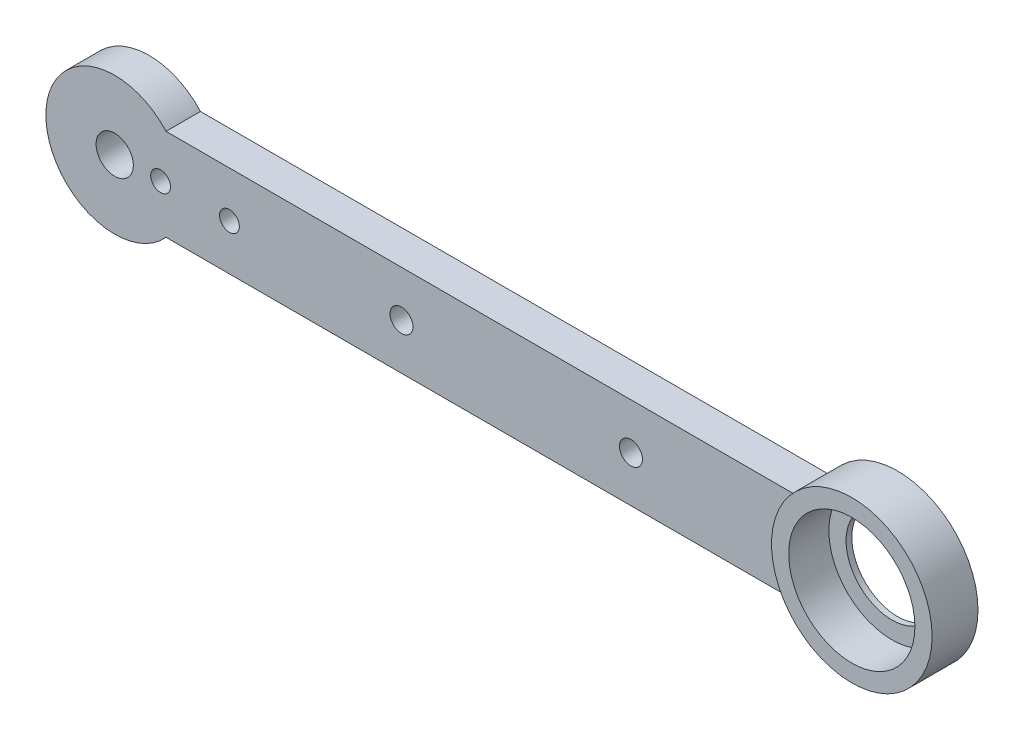
from build123d import *
from build123d.topology import SkipClean

# Parameters (mm, degrees)
BOSS_EXTRUDE1_START     = 3
SKETCH1_W               = 130
SKETCH1_H               = 16
BOSS_EXTRUDE1_DEPTH     = 6
BOSS_EXTRUDE2_START     = 3
SKETCH2_R               = 12
BOSS_EXTRUDE2_DEPTH     = 6
BOSS_EXTRUDE3_START     = 3
SKETCH3_R               = 14
BOSS_EXTRUDE3_DEPTH     = 6
BOSS_EXTRUDE4_START     = 2.5
SKETCH4_R               = 14
BOSS_EXTRUDE4_DEPTH     = 8
CUT_EXTRUDE1_DEPTH      = 146.059470563
CUT_EXTRUDE1_DEPTH_BACK = 146.059470563
SKETCH5_R               = 3.25
CUT_EXTRUDE2_DEPTH      = 146.059470563
CUT_EXTRUDE2_DEPTH_BACK = 146.059470563
SKETCH6_R               = 1.725
CUT_EXTRUDE3_START      = 3
SKETCH7_R               = 2.9
CUT_EXTRUDE3_DEPTH      = 2.2
CUT_EXTRUDE4_START      = 3
SKETCH8_R               = 2.9
CUT_EXTRUDE4_DEPTH      = 2.2
CUT_EXTRUDE5_START      = 3.5
SKETCH9_R               = 11
CUT_EXTRUDE5_DEPTH      = 7
CUT_EXTRUDE6_DEPTH      = 146.059470563
CUT_EXTRUDE6_DEPTH_BACK = 146.059470563
SKETCH10_R              = 8
CUT_EXTRUDE7_START      = 5
SKETCH11_R              = 2
CUT_EXTRUDE7_DEPTH      = 4


with BuildPart() as part:
    # Sketch1 → Boss-Extrude1 (new body)
    with BuildSketch(Plane.XY.offset(BOSS_EXTRUDE1_START)):
        with Locations((65, 0)):
            Rectangle(SKETCH1_W, SKETCH1_H)
    extrude(amount=BOSS_EXTRUDE1_DEPTH)

    # Sketch2 → Boss-Extrude2 (add)
    with BuildSketch(Plane.XY.offset(BOSS_EXTRUDE2_START)):
        Circle(SKETCH2_R)
    extrude(amount=BOSS_EXTRUDE2_DEPTH)

    # Sketch3 → Boss-Extrude3 (add)
    with BuildSketch(Plane.XY.offset(BOSS_EXTRUDE3_START)):
        with Locations((130, 0)):
            Circle(SKETCH3_R)
    extrude(amount=BOSS_EXTRUDE3_DEPTH)

    # Sketch4 → Boss-Extrude4 (add)
    with SkipClean():  # the faces are left unmerged after this step: merging them gives an invalid solid
        with BuildSketch(Plane.XY.offset(BOSS_EXTRUDE4_START)):
            with Locations((130, 0)):
                Circle(SKETCH4_R)
        extrude(amount=BOSS_EXTRUDE4_DEPTH)
    add(part.part.scale(1), mode=Mode.REPLACE)  # the faces are merged on a copy

    # Sketch5 → Cut-Extrude1 (cut, two sides: drawn at the far end of the back side and taken through both)
    with BuildSketch(Plane.XY.offset(-CUT_EXTRUDE1_DEPTH_BACK)):
        Circle(SKETCH5_R)
    extrude(amount=CUT_EXTRUDE1_DEPTH + CUT_EXTRUDE1_DEPTH_BACK, mode=Mode.SUBTRACT)

    # Sketch6 → Cut-Extrude2 (cut, two sides: drawn at the far end of the back side and taken through both)
    with BuildSketch(Plane.XY.offset(-CUT_EXTRUDE2_DEPTH_BACK)):
        with Locations((8, 0)):
            Circle(SKETCH6_R)
        with Locations((20, 0)):
            Circle(SKETCH6_R)
    extrude(amount=CUT_EXTRUDE2_DEPTH + CUT_EXTRUDE2_DEPTH_BACK, mode=Mode.SUBTRACT)

    # Sketch7 → Cut-Extrude3 (cut)
    with BuildSketch(Plane.XY.offset(CUT_EXTRUDE3_START)):
        with Locations((8, 0)):
            Circle(SKETCH7_R)
    extrude(amount=CUT_EXTRUDE3_DEPTH, mode=Mode.SUBTRACT)

    # Sketch8 → Cut-Extrude4 (cut)
    with BuildSketch(Plane.XY.offset(CUT_EXTRUDE4_START)):
        with Locations((20, 0)):
            Circle(SKETCH8_R)
    extrude(amount=CUT_EXTRUDE4_DEPTH, mode=Mode.SUBTRACT)

    # Sketch9 → Cut-Extrude5 (cut)
    with BuildSketch(Plane.XY.offset(CUT_EXTRUDE5_START)):
        with Locations((130, 0)):
            Circle(SKETCH9_R)
    extrude(amount=CUT_EXTRUDE5_DEPTH, mode=Mode.SUBTRACT)

    # Sketch10 → Cut-Extrude6 (cut, two sides: drawn at the far end of the back side and taken through both)
    with BuildSketch(Plane.XY.offset(-CUT_EXTRUDE6_DEPTH_BACK)):
        with Locations((130, 0)):
            Circle(SKETCH10_R)
    extrude(amount=CUT_EXTRUDE6_DEPTH + CUT_EXTRUDE6_DEPTH_BACK, mode=Mode.SUBTRACT)

    # Sketch11 → Cut-Extrude7 (cut)
    with BuildSketch(Plane.XY.offset(CUT_EXTRUDE7_START)):
        with Locations((50, 0)):
            Circle(SKETCH11_R)
        with Locations((90, 0)):
            Circle(SKETCH11_R)
    extrude(amount=CUT_EXTRUDE7_DEPTH, mode=Mode.SUBTRACT)


solid = part.part
